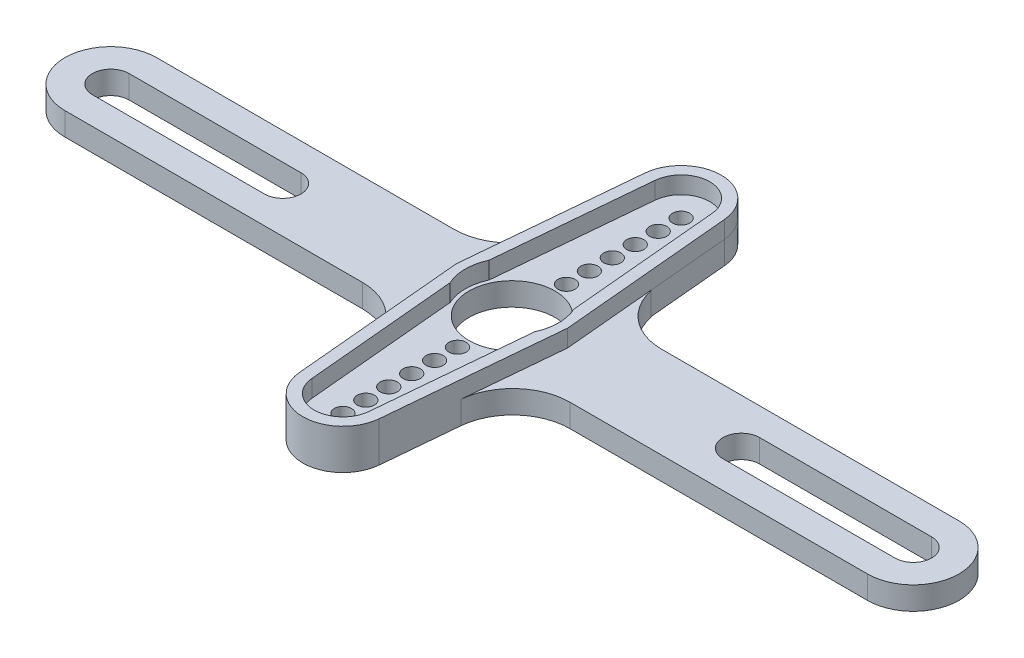
from build123d import *

# Parameters (mm, degrees)
SKETCH1_R               = 1.6
BOSS_EXTRUDE1_DEPTH     = 2
SKETCH2_R               = 0.5
BOSS_EXTRUDE2_DEPTH     = 2
SKETCH3_R               = 1.6
BOSS_EXTRUDE3_DEPTH     = 4
SKETCH4_R               = 5.618069601
SKETCH4_R_2             = 1.5
SKETCH4_R_3             = 9.019483561
CUT_EXTRUDE1_DEPTH      = 20
CUT_EXTRUDE2_DEPTH      = 10
CUT_EXTRUDE2_DEPTH_BACK = 10
SKETCH6_W               = 4
SKETCH6_H               = 1
SKETCH6_R               = 0.5
BOSS_EXTRUDE5_DEPTH     = 2
SKETCH7_R               = 9
SKETCH7_R_2             = 5
BOSS_EXTRUDE6_DEPTH     = 2
SKETCH8_R               = 5
CUT_EXTRUDE3_DEPTH      = 10
SKETCH9_R               = 5
SKETCH9_R_2             = 3.75
BOSS_EXTRUDE7_DEPTH     = 2
BOSS_EXTRUDE9_DEPTH     = 1.5
BOSS_EXTRUDE10_DEPTH    = 2
SKETCH12_R              = 3.75
CUT_EXTRUDE5_DEPTH      = 6.5
SKETCH13_R              = 0.75
CUT_EXTRUDE6_DEPTH      = 6.5
CUT_EXTRUDE8_DEPTH      = 6.5
FILLET2_DEPTH           = 2


with BuildPart() as part:
    # Sketch1 → Boss-Extrude1 (new body)
    with BuildSketch(Plane(origin=(0, 0, 0), x_dir=(1, 0, 0), z_dir=(0, 1, 0))):
        with BuildLine():
            Line((0, 3), (70, 3))
            ThreePointArc((70, 3), (73, 0), (70, -3))
            Line((70, -3), (0, -3))
            ThreePointArc((0, -3), (-3, 0), (0, 3))
        make_face()
        with Locations(Location((0, 0, 0), (0, 0, 270))):
            Circle(SKETCH1_R, mode=Mode.SUBTRACT)
        with Locations(Location((70, 0, 0), (0, 0, 270))):
            Circle(SKETCH1_R, mode=Mode.SUBTRACT)
        with Locations(Location((35, 0, 0), (0, 0, 270))):
            Circle(SKETCH1_R, mode=Mode.SUBTRACT)
    extrude(amount=BOSS_EXTRUDE1_DEPTH)

    # Sketch2 → Boss-Extrude2 (add)
    # profile 1 of 2: a face of its own
    with BuildSketch(Plane(origin=(0, 2, 0), x_dir=(1, 0, 0), z_dir=(0, 1, 0))):
        with BuildLine():
            Line((37, -3), (33, -3))
            Line((33, -3), (33, -14))
            ThreePointArc((33, -14), (35, -16), (37, -14))
            Line((37, -14), (37, -3))
        make_face()
        with Locations(Location((35, -11.5, 0), (0, 0, 270))):
            Circle(SKETCH2_R, mode=Mode.SUBTRACT)
        with Locations(Location((35, -14, 0), (0, 0, 270))):
            Circle(SKETCH2_R, mode=Mode.SUBTRACT)
        with Locations(Location((35, -9.5, 0), (0, 0, 270))):
            Circle(SKETCH2_R, mode=Mode.SUBTRACT)
    # profile 2 of 2: a face of its own
    with BuildSketch(Plane(origin=(0, 2, 0), x_dir=(1, 0, 0), z_dir=(0, 1, 0))):
        with BuildLine():
            Line((33, 14), (33, 3))
            Line((33, 3), (37, 3))
            Line((37, 3), (37, 14))
            ThreePointArc((37, 14), (35, 16), (33, 14))
        make_face()
        with Locations(Location((35, 9.5, 0), (0, 0, 270))):
            Circle(SKETCH2_R, mode=Mode.SUBTRACT)
        with Locations(Location((35, 14, 0), (0, 0, 270))):
            Circle(SKETCH2_R, mode=Mode.SUBTRACT)
        with Locations(Location((35, 11.5, 0), (0, 0, 270))):
            Circle(SKETCH2_R, mode=Mode.SUBTRACT)
    extrude(amount=-BOSS_EXTRUDE2_DEPTH)

    # Sketch3 → Boss-Extrude3 (add)
    with BuildSketch(Plane(origin=(0, 0, 0), x_dir=(-1, 0, 0), z_dir=(0, -1, 0))):
        with Locations(Location((-70, 0, 0), (0, 0, 90))):
            Circle(SKETCH3_R)
        with Locations(Location((0, 0, 0), (0, 0, 90))):
            Circle(SKETCH3_R)
    extrude(amount=-BOSS_EXTRUDE3_DEPTH)

    # Sketch4 → Cut-Extrude1 (cut)
    # profile 1 of 2: a face of its own
    with BuildSketch(Plane(origin=(0, 2, 0), x_dir=(1, 0, 0), z_dir=(0, 1, 0))):
        with Locations((70, 0)):
            Circle(SKETCH4_R)
        with Locations(Location((70, 0, 0), (0, 0, 90))):
            Circle(SKETCH4_R_2, mode=Mode.SUBTRACT)
    # profile 2 of 2: a face of its own
    with BuildSketch(Plane(origin=(0, 2, 0), x_dir=(1, 0, 0), z_dir=(0, 1, 0))):
        Circle(SKETCH4_R_3)
        with Locations(Location((0, 0, 0), (0, 0, 90))):
            Circle(SKETCH4_R_2, mode=Mode.SUBTRACT)
    extrude(amount=CUT_EXTRUDE1_DEPTH, mode=Mode.SUBTRACT)

    # Sketch5 → Cut-Extrude2 (cut, two sides: drawn at the far end of the back side and taken through both)
    with BuildSketch(Plane(origin=(0, 2, 0), x_dir=(1, 0, 0), z_dir=(0, 1, 0)).offset(-CUT_EXTRUDE2_DEPTH_BACK)):
        with BuildLine():
            Line((55, 1.6), (70, 1.6))
            ThreePointArc((70, 1.6), (71.6, 0), (70, -1.6))
            Line((70, -1.6), (55, -1.6))
            ThreePointArc((55, -1.6), (53.4, 0), (55, 1.6))
        make_face()
        with BuildLine():
            Line((0, -1.6), (15, -1.6))
            ThreePointArc((15, -1.6), (16.6, 0), (15, 1.6))
            Line((15, 1.6), (0, 1.6))
            ThreePointArc((0, 1.6), (-1.6, 0), (0, -1.6))
        make_face()
    extrude(amount=CUT_EXTRUDE2_DEPTH + CUT_EXTRUDE2_DEPTH_BACK, mode=Mode.SUBTRACT)

    # Sketch6 → Boss-Extrude5 (add)
    # profile 1 of 5: a face of its own
    with BuildSketch(Plane(origin=(0, 2, 0), x_dir=(1, 0, 0), z_dir=(0, 1, 0))):
        with Locations((35, 3.5)):
            Rectangle(SKETCH6_W, SKETCH6_H)
    # profile 2 of 5: a face of its own
    with BuildSketch(Plane(origin=(0, 2, 0), x_dir=(1, 0, 0), z_dir=(0, 1, 0))):
        with BuildLine():
            Line((33, 4), (0, 4))
            ThreePointArc((0, 4), (-4, 0), (0, -4))
            Line((0, -4), (33, -4))
            Line((33, -4), (33, -3))
            Line((33, -3), (0, -3))
            ThreePointArc((0, -3), (-3, 0), (0, 3))
            Line((0, 3), (33, 3))
            Line((33, 3), (33, 4))
        make_face()
    # profile 3 of 5: a face of its own
    with BuildSketch(Plane(origin=(0, 2, 0), x_dir=(1, 0, 0), z_dir=(0, 1, 0))):
        with BuildLine():
            Line((70, 4), (37, 4))
            Line((37, 4), (37, 3))
            Line((37, 3), (70, 3))
            ThreePointArc((70, 3), (73, 0), (70, -3))
            Line((70, -3), (37, -3))
            Line((37, -3), (37, -4))
            Line((37, -4), (70, -4))
            ThreePointArc((70, -4), (74, 0), (70, 4))
        make_face()
    # profile 4 of 5: a face of its own
    with BuildSketch(Plane(origin=(0, 2, 0), x_dir=(1, 0, 0), z_dir=(0, 1, 0))):
        with Locations((35, -3.5)):
            Rectangle(SKETCH6_W, SKETCH6_H)
    # profile 5 of 5: a face of its own
    with BuildSketch(Plane(origin=(0, 2, 0), x_dir=(1, 0, 0), z_dir=(0, 1, 0))):
        with BuildLine():
            Line((33, 14), (33, 4))
            Line((33, 4), (37, 4))
            Line((37, 4), (37, 14))
            ThreePointArc((37, 14), (35, 16), (33, 14))
        make_face()
        with Locations(Location((35, 9.5, 0), (0, 0, 270))):
            Circle(SKETCH6_R, mode=Mode.SUBTRACT)
        with Locations(Location((35, 11.5, 0), (0, 0, 270))):
            Circle(SKETCH6_R, mode=Mode.SUBTRACT)
        with Locations(Location((35, 14, 0), (0, 0, 270))):
            Circle(SKETCH6_R, mode=Mode.SUBTRACT)
    extrude(amount=-BOSS_EXTRUDE5_DEPTH)

    # Sketch7 → Boss-Extrude6 (add)
    with BuildSketch(Plane(origin=(0, 2, 0), x_dir=(1, 0, 0), z_dir=(0, 1, 0))):
        with Locations((35, 0)):
            Circle(SKETCH7_R)
        with Locations((35, 0)):
            Circle(SKETCH7_R_2, mode=Mode.SUBTRACT)
    extrude(amount=-BOSS_EXTRUDE6_DEPTH)

    # Sketch8 → Cut-Extrude3 (cut)
    with BuildSketch(Plane(origin=(0, 2, 0), x_dir=(1, 0, 0), z_dir=(0, 1, 0))):
        with Locations(Location((35, 0, 0), (0, 0, 270))):
            Circle(SKETCH8_R)
    extrude(amount=-CUT_EXTRUDE3_DEPTH, mode=Mode.SUBTRACT)

    # Sketch9 → Boss-Extrude7 (add)
    with BuildSketch(Plane(origin=(0, 2, 0), x_dir=(1, 0, 0), z_dir=(0, 1, 0))):
        with Locations((35, 0)):
            Circle(SKETCH9_R)
        with Locations(Location((35, 0, 0), (0, 0, 270))):
            Circle(SKETCH9_R_2, mode=Mode.SUBTRACT)
    extrude(amount=-BOSS_EXTRUDE7_DEPTH)

    # Sketch10 → Boss-Extrude9 (add)
    with BuildSketch(Plane(origin=(0, 2, 0), x_dir=(1, 0, 0), z_dir=(0, 1, 0))):
        with BuildLine():
            Line((39.090633308, -8.429228841), (38.485551099, -15.067700384))
            ThreePointArc((38.485551099, -15.067700384), (35, -18.25), (31.514448901, -15.067700384))
            Line((31.514448901, -15.067700384), (30.909366692, -8.429228841))
            Line((30.909366692, -8.429228841), (30.141060861, 0))
            Line((30.141060861, 0), (31.514318053, 15.067682419))
            ThreePointArc((31.514318053, 15.067682419), (35, 18.250128677), (38.485681947, 15.067682419))
            Line((38.485681947, 15.067682419), (39.858939139, 0))
            Line((39.858939139, 0), (39.090633308, -8.429228841))
        make_face()
        with BuildLine():
            Line((38.699843773, 1.69998576), (37.489679357, 14.976928845))
            ThreePointArc((37.489679357, 14.976928845), (35, 17.25), (32.510320643, 14.976928845))
            Line((32.510320643, 14.976928845), (31.300156227, 1.69998576))
            ThreePointArc((31.300156227, 1.69998576), (30.92829329, 0), (31.300156227, -1.69998576))
            Line((31.300156227, -1.69998576), (32.510320643, -14.976928845))
            ThreePointArc((32.510320643, -14.976928845), (35, -17.25), (37.489679357, -14.976928845))
            Line((37.489679357, -14.976928845), (38.699843773, -1.69998576))
            ThreePointArc((38.699843773, -1.69998576), (39.07170671, 0), (38.699843773, 1.69998576))
        make_face(mode=Mode.SUBTRACT)
    extrude(amount=BOSS_EXTRUDE9_DEPTH)

    # Sketch11 → Boss-Extrude10 (add)
    with BuildSketch(Plane(origin=(0, 2, 0), x_dir=(-1, 0, 0), z_dir=(0, -1, 0))):
        with BuildLine():
            Line((-37.489679357, -14.976928845), (-38.084133031, -8.455064958))
            ThreePointArc((-38.084133031, -8.455064958), (-38.614391825, -8.242340186), (-39.130084789, -7.996399167))
            Line((-39.130084789, -7.996399167), (-38.485551099, -15.067700384))
            ThreePointArc((-38.485551099, -15.067700384), (-35, -18.25), (-31.514448901, -15.067700384))
            Line((-31.514448901, -15.067700384), (-30.869915211, -7.996399167))
            ThreePointArc((-30.869915211, -7.996399167), (-31.385608175, -8.242340186), (-31.915866969, -8.455064958))
            Line((-31.915866969, -8.455064958), (-32.510320643, -14.976928845))
            ThreePointArc((-32.510320643, -14.976928845), (-35, -17.25), (-37.489679357, -14.976928845))
        make_face()
        with BuildLine():
            Line((-30.869915211, -7.996399167), (-39.130084789, -7.996399167))
            ThreePointArc((-39.130084789, -7.996399167), (-38.614391825, -8.242340186), (-38.084133031, -8.455064958))
            Line((-38.084133031, -8.455064958), (-37.489679357, -14.976928845))
            ThreePointArc((-37.489679357, -14.976928845), (-35, -17.25), (-32.510320643, -14.976928845))
            Line((-32.510320643, -14.976928845), (-31.915866969, -8.455064958))
            ThreePointArc((-31.915866969, -8.455064958), (-31.385608175, -8.242340186), (-30.869915211, -7.996399167))
        make_face()
        with BuildLine():
            ThreePointArc((-39.130084789, 7.996399167), (-35, 9), (-30.869915211, 7.996399167))
            Line((-30.869915211, 7.996399167), (-31.514448901, 15.067700384))
            ThreePointArc((-31.514448901, 15.067700384), (-35, 18.25), (-38.485551099, 15.067700384))
            Line((-38.485551099, 15.067700384), (-39.130084789, 7.996399167))
        make_face()
        with BuildLine():
            Line((-39.130084789, -7.996399167), (-30.869915211, -7.996399167))
            ThreePointArc((-30.869915211, -7.996399167), (-26, 0), (-30.869915211, 7.996399167))
            Line((-30.869915211, 7.996399167), (-39.130084789, 7.996399167))
            ThreePointArc((-39.130084789, 7.996399167), (-44, 0), (-39.130084789, -7.996399167))
        make_face()
    extrude(amount=BOSS_EXTRUDE10_DEPTH)

    # Sketch12 → Cut-Extrude5 (cut)
    with BuildSketch(Plane(origin=(0, 2, 0), x_dir=(1, 0, 0), z_dir=(0, 1, 0))):
        with Locations(Location((35, 0, 0), (0, 0, 270))):
            Circle(SKETCH12_R)
    extrude(amount=-CUT_EXTRUDE5_DEPTH, mode=Mode.SUBTRACT)

    # Sketch13 → Cut-Extrude6 (cut)
    with BuildSketch(Plane(origin=(0, 2, 0), x_dir=(1, 0, 0), z_dir=(0, 1, 0))):
        with Locations(Location((35, 14.75, 0), (0, 0, 270))):
            Circle(SKETCH13_R)
        with Locations(Location((35, 12.75, 0), (0, 0, 270))):
            Circle(SKETCH13_R)
        with Locations(Location((35, 10.75, 0), (0, 0, 270))):
            Circle(SKETCH13_R)
        with Locations(Location((35, 8.75, 0), (0, 0, 270))):
            Circle(SKETCH13_R)
        with Locations(Location((35, 6.75, 0), (0, 0, 270))):
            Circle(SKETCH13_R)
        with Locations(Location((35, 4.75, 0), (0, 0, 270))):
            Circle(SKETCH13_R)
        with Locations(Location((35, -4.75, 0), (0, 0, 270))):
            Circle(SKETCH13_R)
        with Locations(Location((35, -6.75, 0), (0, 0, 270))):
            Circle(SKETCH13_R)
        with Locations(Location((35, -8.75, 0), (0, 0, 270))):
            Circle(SKETCH13_R)
        with Locations(Location((35, -10.75, 0), (0, 0, 270))):
            Circle(SKETCH13_R)
        with Locations(Location((35, -12.75, 0), (0, 0, 270))):
            Circle(SKETCH13_R)
        with Locations(Location((35, -14.75, 0), (0, 0, 270))):
            Circle(SKETCH13_R)
    extrude(amount=-CUT_EXTRUDE6_DEPTH, mode=Mode.SUBTRACT)

    # Sketch14 → Cut-Extrude8 (cut)
    with BuildSketch(Plane(origin=(0, 2, 0), x_dir=(1, 0, 0), z_dir=(0, 1, 0))):
        Polygon((43.062257748, 4), (39.494547944, 3.998181), (39.130156748, 7.996362), (43.062257748, 8.354730715), align=None)
        Polygon((26.937742252, 4), (30.505452056, 3.998181), (30.869915211, 7.996399167), (26.937742252, 8.354841879), align=None)
        Polygon((26.937742252, -4), (30.505488036, -3.998199584), (30.869915211, -7.996399167), (26.937742252, -8.35480816), align=None)
        Polygon((43.062257748, -4), (39.494511964, -3.998199584), (39.130084789, -7.996399167), (43.062257748, -8.35480816), align=None)
    extrude(amount=-CUT_EXTRUDE8_DEPTH, mode=Mode.SUBTRACT)

    # Fillet2: read off the stored shape, not the designer's step
    # Fillet2 outline → Fillet2 (add)
    with BuildSketch(Plane(origin=(0, 0, 0), x_dir=(1, 0, 0), z_dir=(0, 1, 0))):
        with BuildLine():
            ThreePointArc((44.059408899, 4), (40.905713278, 5.120025267), (39.164905169, 7.978318428))
            ThreePointArc((39.164905169, 7.978318428), (39.147504832, 7.987377772), (39.130084789, 7.996399167))
            Line((39.130084789, 7.996399167), (39.494547943, 3.998181))
            Line((39.494547943, 3.998181), (43.062257748, 4))
            Line((43.062257748, 4), (44.059408899, 4))
        make_face()
        with BuildLine():
            Line((43.062257748, -4), (39.494511964, -3.998199584))
            Line((39.494511964, -3.998199584), (39.0799769, -8.546142309))
            ThreePointArc((39.0799769, -8.546142309), (40.688081281, -5.307488087), (44.059335613, -4))
            Line((44.059335613, -4), (43.062257748, -4))
        make_face()
        with BuildLine():
            Line((26.937742252, -4), (25.940664387, -4))
            ThreePointArc((25.940664387, -4), (29.311918719, -5.307488087), (30.9200231, -8.546142309))
            Line((30.9200231, -8.546142309), (30.505488036, -3.998199584))
            Line((30.505488036, -3.998199584), (26.937742252, -4))
        make_face()
        with BuildLine():
            ThreePointArc((30.9200231, 8.546142309), (29.311918719, 5.307488087), (25.940664387, 4))
            Line((25.940664387, 4), (26.937742252, 4))
            Line((26.937742252, 4), (30.505452056, 3.998181))
            Line((30.505452056, 3.998181), (30.869915211, 7.996399167))
            Line((30.869915211, 7.996399167), (30.9200231, 8.546142309))
        make_face()
    extrude(amount=FILLET2_DEPTH)


solid = part.part
